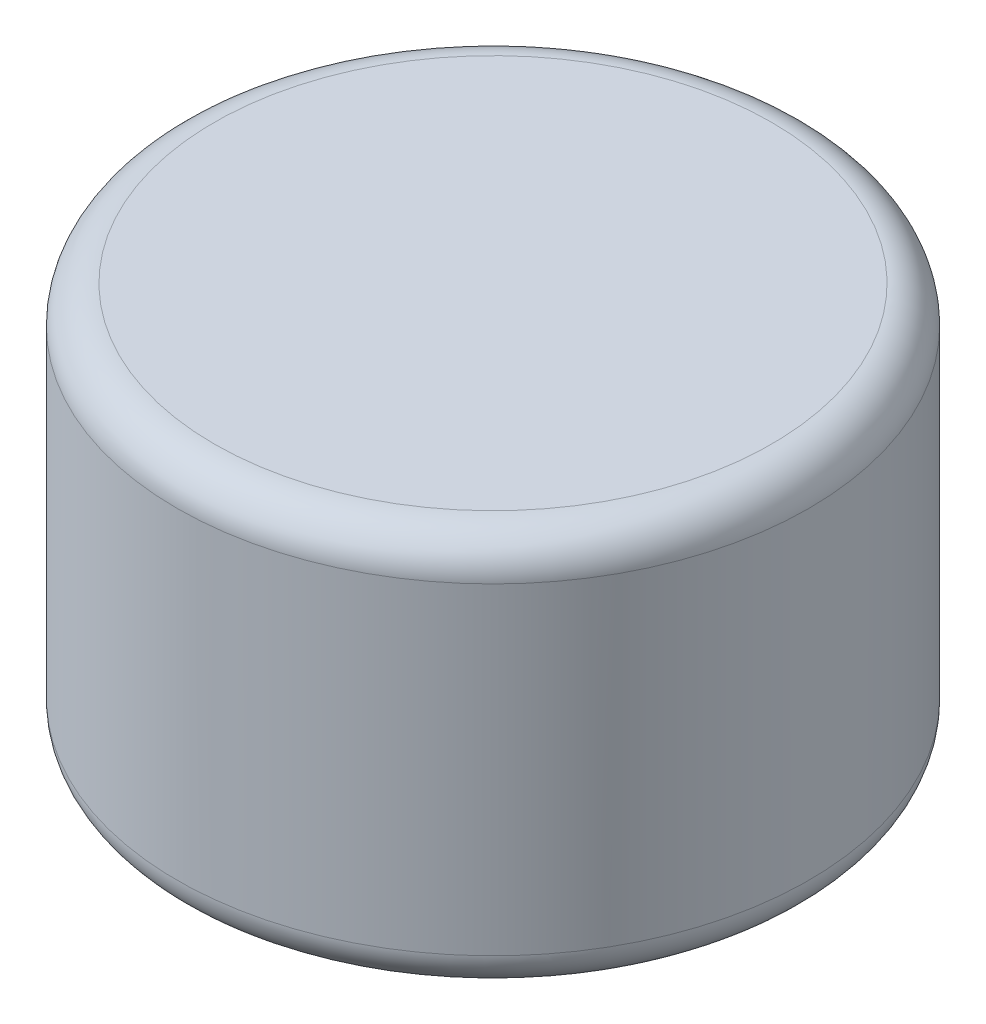
from build123d import *

# Parameters (mm, degrees)
FILLET2_R = 1.5


with BuildPart() as part:
    # Sketch2 → Revolve1 (revolve)
    with BuildSketch(Plane.XY):
        Polygon((0, 16), (0, 15.25), (12, 15.25), (12, 0.75), (0, 0.75), (0, 0), (12.75, 0), (12.75, 16), align=None)
    revolve(axis=Axis((0, 0, 0), (0, 1, 0)))

    # Fillet2
    fillet2_edges = [part.edges().sort_by_distance(p)[0] for p in [
        (-12.75, 0, 0),
        (-12.75, 16, 0),
    ]]
    fillet(fillet2_edges, radius=FILLET2_R)


solid = part.part
